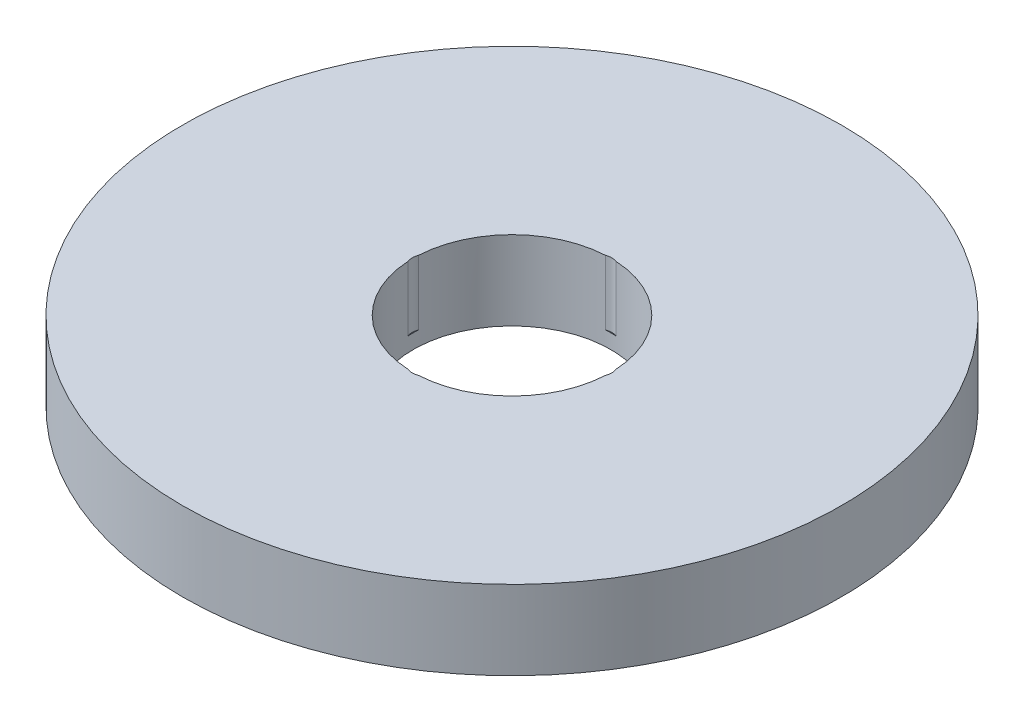
from build123d import *

# Parameters (mm, degrees)
SKETCH1_R           = 50
BOSS_EXTRUDE1_DEPTH = 12
SKETCH2_R           = 15
CUT_EXTRUDE1_DEPTH  = 72.721684308
SKETCH3_R           = 2.106012959
CUT_EXTRUDE2_DEPTH  = 9.798960857
CIRPATTERN1_COUNT   = 4


with BuildPart() as part:
    # Sketch1 → Boss-Extrude1 (new body)
    with BuildSketch(Plane(origin=(0, 0, 0), x_dir=(1, 0, 0), z_dir=(0, 1, 0))):
        Circle(SKETCH1_R)
    extrude(amount=BOSS_EXTRUDE1_DEPTH)

    # Sketch2 → Cut-Extrude1 (cut, through all)
    with BuildSketch(Plane(origin=(0, 0, 0), x_dir=(1, 0, 0), z_dir=(0, 1, 0))):
        Circle(SKETCH2_R)
    extrude(amount=CUT_EXTRUDE1_DEPTH, mode=Mode.SUBTRACT)

    # Sketch3 → Cut-Extrude2 (cut)
    with BuildSketch(Plane(origin=(0, 12, 0), x_dir=(1, 0, 0), z_dir=(0, 1, 0))):
        with Locations((-13.024133765, 0)):
            Circle(SKETCH3_R)
    cut_extrude2 = extrude(amount=-CUT_EXTRUDE2_DEPTH, mode=Mode.SUBTRACT)

    # CirPattern1: Cut-Extrude2 ×4 about axis
    cirpattern1_axis = Axis((0, 0, 0), (0, 1, 0))
    for i in range(1, CIRPATTERN1_COUNT):
        add(cut_extrude2.rotate(cirpattern1_axis, i * 360 / CIRPATTERN1_COUNT), mode=Mode.SUBTRACT)


solid = part.part
